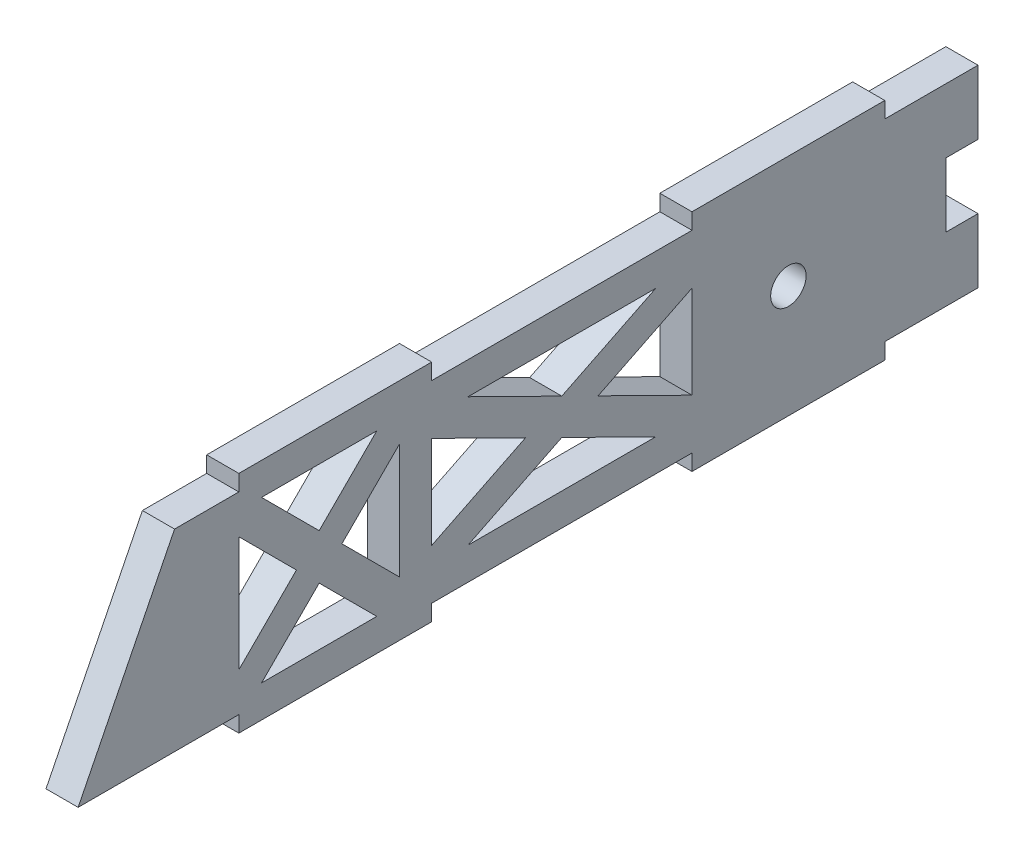
from build123d import *

# Parameters (mm, degrees)
SKETCH1_W               = 355.6
SKETCH1_H               = 76.2
BOSS_EXTRUDE1_DEPTH     = 12.7
CUT_EXTRUDE1_DEPTH      = 183.279291199
CUT_EXTRUDE1_DEPTH_BACK = 183.279291199
SKETCH3_W               = 76.2
SKETCH3_H               = 6.35
BOSS_EXTRUDE2_DEPTH     = 12.7
SKETCH4_W               = 12.7
SKETCH4_H               = 25.4
CUT_EXTRUDE2_DEPTH      = 184.711546997
SKETCH5_R               = 7
CUT_EXTRUDE3_DEPTH      = 184.711546997
CUT_EXTRUDE4_DEPTH      = 184.711546997


with BuildPart() as part:
    # Sketch1 → Boss-Extrude1 (new body)
    with BuildSketch(Plane(origin=(0, 0, 0), x_dir=(0, 0, -1), z_dir=(1, 0, 0))):
        Rectangle(SKETCH1_W, SKETCH1_H)
    extrude(amount=BOSS_EXTRUDE1_DEPTH)

    # Sketch2 → Cut-Extrude1 (cut, two sides: drawn at the far end of the back side and taken through both)
    with BuildSketch(Plane(origin=(12.7, 0, 0), x_dir=(0, 0, -1), z_dir=(1, 0, 0)).offset(-CUT_EXTRUDE1_DEPTH_BACK)):
        Polygon((-507.550847217, -697.601694433), (-177.8, -38.1), (-139.7, 38.1), (190.050847217, 697.601694433), (-1128.95254165, 1357.103388866), (-1826.554236083, -38.1), align=None)
    extrude(amount=CUT_EXTRUDE1_DEPTH + CUT_EXTRUDE1_DEPTH_BACK, mode=Mode.SUBTRACT)

    # Sketch3 → Boss-Extrude2 (add)
    with BuildSketch(Plane.ZY):
        with Locations((-102.87, -41.275)):
            Rectangle(SKETCH3_W, SKETCH3_H)
        with Locations((76.2, -41.275)):
            Rectangle(SKETCH3_W, SKETCH3_H)
        with Locations((-102.87, 41.275)):
            Rectangle(SKETCH3_W, SKETCH3_H)
        with Locations((76.2, 41.275)):
            Rectangle(SKETCH3_W, SKETCH3_H)
    extrude(amount=-BOSS_EXTRUDE2_DEPTH)

    # Sketch4 → Cut-Extrude2 (cut, through all)
    with BuildSketch(Plane.ZY):
        with Locations((-171.45, 0)):
            Rectangle(SKETCH4_W, SKETCH4_H)
    extrude(amount=-CUT_EXTRUDE2_DEPTH, mode=Mode.SUBTRACT)

    # Sketch5 → Cut-Extrude3 (cut, through all)
    with BuildSketch(Plane.ZY):
        with Locations((-102.87, 0)):
            Circle(SKETCH5_R)
    extrude(amount=-CUT_EXTRUDE3_DEPTH, mode=Mode.SUBTRACT)

    # Sketch6 → Cut-Extrude4 (cut, through all)
    with BuildSketch(Plane.ZY):
        Polygon((23.758802297, 25.4), (-50.428802297, 25.4), (-13.335, 7.08207294), align=None)
        Polygon((-27.676197703, 0), (-64.77, 18.31792706), (-64.77, -18.31792706), align=None)
        Polygon((38.1, -18.31792706), (38.1, 18.31792706), (1.006197703, 0), align=None)
        Polygon((-13.335, -7.08207294), (-50.428802297, -25.4), (23.758802297, -25.4), align=None)
        Polygon((105.319743879, 31.75), (59.780256121, 31.75), (82.55, 8.980256121), align=None)
        Polygon((73.569743879, 0), (50.8, 22.769743879), (50.8, -22.769743879), align=None)
        Polygon((114.3, 22.769743879), (91.530256121, 0), (114.3, -22.769743879), align=None)
        Polygon((105.319743879, -31.75), (82.55, -8.980256121), (59.780256121, -31.75), align=None)
    extrude(amount=-CUT_EXTRUDE4_DEPTH, mode=Mode.SUBTRACT)


solid = part.part
